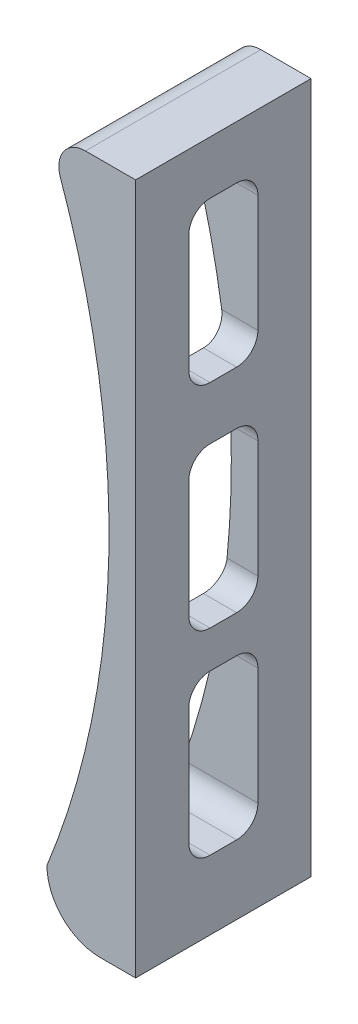
from build123d import *

# Parameters (mm, degrees)
RESSALTO_EXTRUS_O1_DEPTH = 33
FILETE1_START            = -1
FILETE1_DEPTH            = 35
FILETE1_2_DEPTH          = 33
CORTE_EXTRUS_O2_DEPTH    = 166.099690852
ESBO_O4_W                = 39.149175328
ESBO_O4_H                = 26.52668984
CORTE_EXTRUS_O3_DEPTH    = 166.099690852
ESBO_O5_W                = 74.27128815
ESBO_O5_H                = 142.377248688
CORTE_EXTRUS_O4_DEPTH    = 166.099690852
FILETE2_R                = 5
CORTE_EXTRUS_O5_DEPTH    = 163.400408603


with BuildPart() as part:
    # Esboço1 → Ressalto-extrusão1 (new body)
    with BuildSketch(Plane.XY):
        with BuildLine():
            Line((-14.089663978, 13.135393664), (-14.089663978, 28.135393664))
            Line((-14.089663978, 28.135393664), (-34.089663978, 28.135393664))
            Line((-34.089663978, 28.135393664), (-34.089663978, 158.135393664))
            Line((-34.089663978, 158.135393664), (25.910336022, 158.135393664))
            Line((25.910336022, 158.135393664), (25.910336022, 28.135393664))
            Line((25.910336022, 28.135393664), (5.910336022, 28.135393664))
            Line((5.910336022, 28.135393664), (5.910336022, 13.135393664))
            ThreePointArc((5.910336022, 13.135393664), (-4.089663978, 3.135393664), (-14.089663978, 13.135393664))
        make_face()
    extrude(amount=RESSALTO_EXTRUS_O1_DEPTH)

    # Filete1: read off the stored shape, not the designer's step
    # Filete1 outline → Filete1 (cut)
    with BuildSketch(Plane.XY.offset(FILETE1_START)):
        with BuildLine():
            Line((25.910336022, 28.135393664), (25.910336022, 38.135393664))
            ThreePointArc((25.910336022, 38.135393664), (22.981403834, 31.064325852), (15.910336022, 28.135393664))
            Line((15.910336022, 28.135393664), (25.910336022, 28.135393664))
        make_face()
        with BuildLine():
            Line((-34.089663978, 28.135393664), (-24.089663978, 28.135393664))
            ThreePointArc((-24.089663978, 28.135393664), (-31.160731789, 31.064325853), (-34.089663978, 38.135393664))
            Line((-34.089663978, 38.135393664), (-34.089663978, 28.135393664))
        make_face()
    extrude(amount=FILETE1_DEPTH, mode=Mode.SUBTRACT)

    # Filete1 2 outline → Filete1 2 (add)
    with BuildSketch(Plane.XY):
        with BuildLine():
            ThreePointArc((5.910336022, 18.135393664), (8.83926821, 25.206461475), (15.910336022, 28.135393664))
            Line((15.910336022, 28.135393664), (5.910336022, 28.135393664))
            Line((5.910336022, 28.135393664), (5.910336022, 18.135393664))
        make_face()
        with BuildLine():
            ThreePointArc((-24.089663978, 28.135393664), (-17.018596166, 25.206461476), (-14.089663978, 18.135393664))
            Line((-14.089663978, 18.135393664), (-14.089663978, 28.135393664))
            Line((-14.089663978, 28.135393664), (-24.089663978, 28.135393664))
        make_face()
    extrude(amount=FILETE1_2_DEPTH)

    # Esboço3 → Corte-extrusão2 (cut, through all)
    with BuildSketch(Plane.XY.offset(33)):
        with BuildLine():
            ThreePointArc((-34.089663978, 38.135393664), (-22.413633719, 98.135393664), (-34.089663978, 158.135393664))
            Line((-34.089663978, 158.135393664), (-34.089663978, 38.135393664))
        make_face()
        with BuildLine():
            ThreePointArc((25.910336022, 38.135393664), (14.234305764, 98.135393664), (25.910336022, 158.135393664))
            Line((25.910336022, 158.135393664), (25.910336022, 38.135393664))
        make_face()
    extrude(amount=-CORTE_EXTRUS_O2_DEPTH, mode=Mode.SUBTRACT)

    # Esboço4 → Corte-extrusão3 (cut, through all)
    with BuildSketch(Plane.XY.offset(33)):
        with Locations((-4.515076314, 14.872048744)):
            Rectangle(ESBO_O4_W, ESBO_O4_H)
    extrude(amount=-CORTE_EXTRUS_O3_DEPTH, mode=Mode.SUBTRACT)

    # Esboço5 → Corte-extrusão4 (cut, through all)
    with BuildSketch(Plane.XY.offset(33)):
        with Locations((19.722010356, 86.94676932)):
            Rectangle(ESBO_O5_W, ESBO_O5_H)
    extrude(amount=-CORTE_EXTRUS_O4_DEPTH, mode=Mode.SUBTRACT)

    # Filete2
    filete2_edges = [part.edges().sort_by_distance(p)[0] for p in [
        (-34.089663978, 158.135393664, 16.5),
    ]]
    fillet(filete2_edges, radius=FILETE2_R)

    # Esboço6 → Corte-extrusão5 (cut, through all)
    with BuildSketch(Plane(origin=(-17.413633719, 0, 0), x_dir=(0, 0, -1), z_dir=(1, 0, 0))):
        with BuildLine():
            Line((-19, 148.135393664), (-14, 148.135393664))
            ThreePointArc((-14, 148.135393664), (-11.171572875, 146.963820789), (-10, 144.135393664))
            Line((-10, 144.135393664), (-10, 122.135393664))
            ThreePointArc((-10, 122.135393664), (-11.171572875, 119.306966539), (-14, 118.135393664))
            Line((-14, 118.135393664), (-19, 118.135393664))
            ThreePointArc((-19, 118.135393664), (-21.828427125, 119.306966539), (-23, 122.135393664))
            Line((-23, 122.135393664), (-23, 144.135393664))
            ThreePointArc((-23, 144.135393664), (-21.828427125, 146.963820789), (-19, 148.135393664))
        make_face()
        with BuildLine():
            Line((-19, 108.135393664), (-14, 108.135393664))
            ThreePointArc((-14, 108.135393664), (-11.171572875, 106.963820789), (-10, 104.135393664))
            Line((-10, 104.135393664), (-10, 82.135393664))
            ThreePointArc((-10, 82.135393664), (-11.171572875, 79.306966539), (-14, 78.135393664))
            Line((-14, 78.135393664), (-19, 78.135393664))
            ThreePointArc((-19, 78.135393664), (-21.828427125, 79.306966539), (-23, 82.135393664))
            Line((-23, 82.135393664), (-23, 104.135393664))
            ThreePointArc((-23, 104.135393664), (-21.828427125, 106.963820789), (-19, 108.135393664))
        make_face()
        with BuildLine():
            Line((-19, 71.135393664), (-14, 71.135393664))
            ThreePointArc((-14, 71.135393664), (-11.171572875, 69.963820789), (-10, 67.135393664))
            Line((-10, 67.135393664), (-10, 45.135393664))
            ThreePointArc((-10, 45.135393664), (-11.171572875, 42.306966539), (-14, 41.135393664))
            Line((-14, 41.135393664), (-19, 41.135393664))
            ThreePointArc((-19, 41.135393664), (-21.828427125, 42.306966539), (-23, 45.135393664))
            Line((-23, 45.135393664), (-23, 67.135393664))
            ThreePointArc((-23, 67.135393664), (-21.828427125, 69.963820789), (-19, 71.135393664))
        make_face()
    extrude(amount=-CORTE_EXTRUS_O5_DEPTH, mode=Mode.SUBTRACT)


solid = part.part
